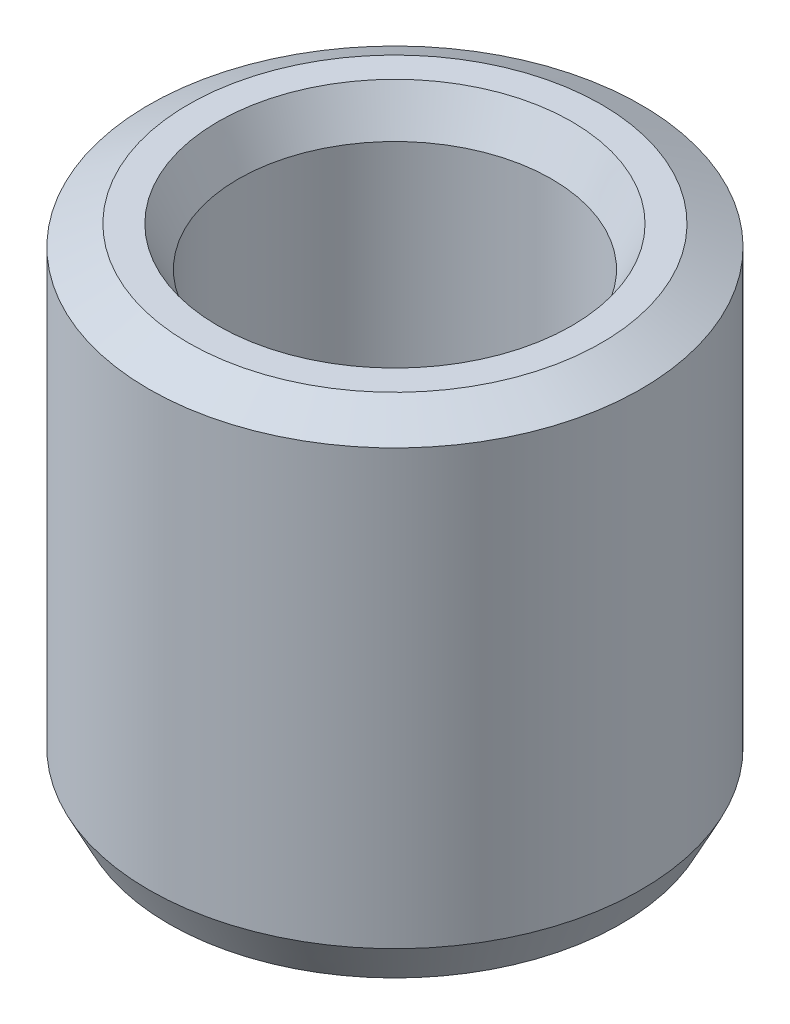
from build123d import *
from OCP.BRepFilletAPI import BRepFilletAPI_MakeChamfer

# Parameters (mm, degrees)
SKETCH1_R           = 37.5
BOSS_EXTRUDE1_DEPTH = 75.175865
SKETCH2_R           = 23.870676016
CUT_EXTRUDE1_DEPTH  = 92.999514556
CHAMFER1_SIZE       = 3.073451563
CHAMFER1_SIZE2      = 6.035465223


with BuildPart() as part:
    # Sketch1 → Boss-Extrude1 (new body)
    with BuildSketch(Plane(origin=(0, 0, 0), x_dir=(1, 0, 0), z_dir=(0, 1, 0))):
        Circle(SKETCH1_R)
    extrude(amount=BOSS_EXTRUDE1_DEPTH)

    # Sketch2 → Cut-Extrude1 (cut, through all)
    with BuildSketch(Plane(origin=(0, 0, 0), x_dir=(1, 0, 0), z_dir=(0, 1, 0))):
        Circle(SKETCH2_R)
    extrude(amount=CUT_EXTRUDE1_DEPTH, mode=Mode.SUBTRACT)

    # Chamfer1: one chamfer whose edges measure the first distance from different faces: ONE call of the kernel's chamfer builder (chamfer() names one face for all edges)
    chamfer1_edges_1 = [part.edges().sort_by_distance(p)[0] for p in [
        (-23.870676016, 75.175865, 0),
    ]]
    chamfer1_side_1 = [part.faces().sort_by_distance(p)[0] for p in [
        (-36.439339828, 75.175865, 0),
    ]]
    chamfer1_edges_2 = [part.edges().sort_by_distance(p)[0] for p in [
        (-23.870676016, 0, 0),
    ]]
    chamfer1_side_2 = [part.faces().sort_by_distance(p)[0] for p in [
        (-23.870676016, 37.5879325, 0),
    ]]
    chamfer1_edges_3 = [part.edges().sort_by_distance(p)[0] for p in [
        (-37.5, 0, 0),
    ]]
    chamfer1_side_3 = [part.faces().sort_by_distance(p)[0] for p in [
        (-36.439339828, 0, 0),
    ]]
    chamfer1_edges_4 = [part.edges().sort_by_distance(p)[0] for p in [
        (-37.5, 75.175865, 0),
    ]]
    chamfer1_side_4 = [part.faces().sort_by_distance(p)[0] for p in [
        (-37.5, 37.5879325, 0),
    ]]
    chamfer1 = BRepFilletAPI_MakeChamfer(part.part.solid().wrapped)
    for e in chamfer1_edges_1:
        chamfer1.Add(CHAMFER1_SIZE, CHAMFER1_SIZE2, e.wrapped, chamfer1_side_1[0].wrapped)  # the first distance lies on this face
    for e in chamfer1_edges_2:
        chamfer1.Add(CHAMFER1_SIZE, CHAMFER1_SIZE2, e.wrapped, chamfer1_side_2[0].wrapped)  # the first distance lies on this face
    for e in chamfer1_edges_3:
        chamfer1.Add(CHAMFER1_SIZE, CHAMFER1_SIZE2, e.wrapped, chamfer1_side_3[0].wrapped)  # the first distance lies on this face
    for e in chamfer1_edges_4:
        chamfer1.Add(CHAMFER1_SIZE, CHAMFER1_SIZE2, e.wrapped, chamfer1_side_4[0].wrapped)  # the first distance lies on this face
    add(Compound.cast(chamfer1.Shape()), mode=Mode.REPLACE)


solid = part.part
